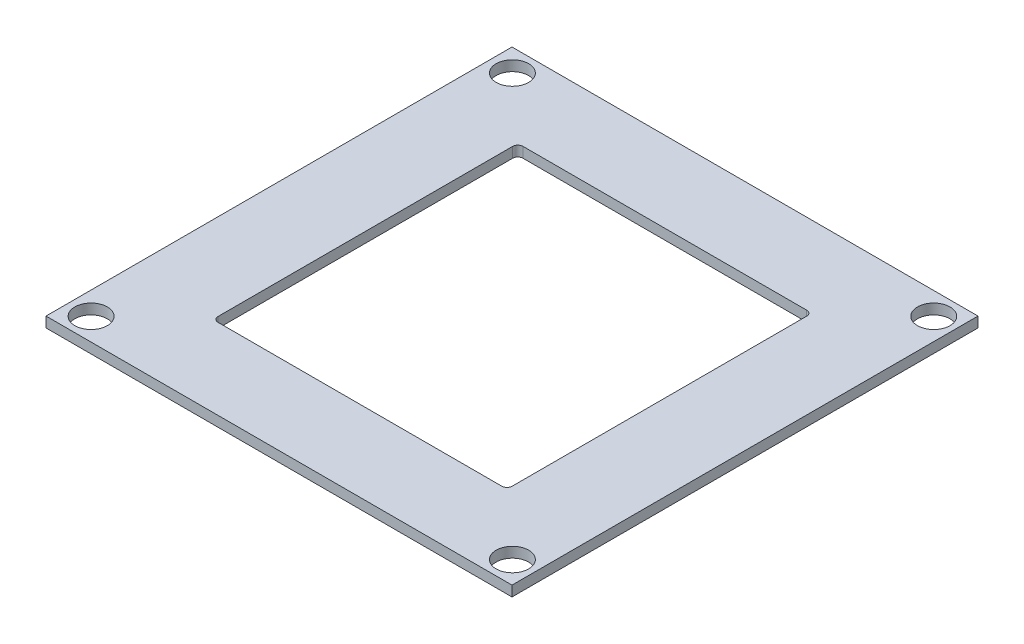
from build123d import *

# Parameters (mm, degrees)
SKETCH1_W           = 286.791999948
SKETCH1_H           = 286.791999948
BOSS_EXTRUDE1_DEPTH = 6.35
SKETCH2_R           = 10
SKETCH2_W           = 180.979932016
SKETCH2_H           = 187.647432016
CUT_EXTRUDE1_DEPTH  = 6.35
FILLET1_R           = 3.175


with BuildPart() as part:
    # Sketch1 → Boss-Extrude1 (new body)
    with BuildSketch(Plane(origin=(0, 0, 0), x_dir=(1, 0, 0), z_dir=(0, 1, 0))):
        with Locations((143.395999974, 0)):
            Rectangle(SKETCH1_W, SKETCH1_H)
    extrude(amount=BOSS_EXTRUDE1_DEPTH)

    # Sketch2 → Cut-Extrude1 (cut)
    with BuildSketch(Plane.XZ):
        with Locations((273.299999948, -129.649999974)):
            Circle(SKETCH2_R)
        with Locations((14, -129.649999974)):
            Circle(SKETCH2_R)
        with Locations((14, 129.649999974)):
            Circle(SKETCH2_R)
        with Locations((273.299999948, 129.649999974)):
            Circle(SKETCH2_R)
        with Locations((143.649999974, 0)):
            Rectangle(SKETCH2_W, SKETCH2_H)
    extrude(amount=-CUT_EXTRUDE1_DEPTH, mode=Mode.SUBTRACT)

    # Fillet1
    fillet1_edges = [part.edges().sort_by_distance(p)[0] for p in [
        (53.160033966, 3.175, -93.823716008),
        (234.139965982, 3.175, -93.823716008),
        (234.139965982, 3.175, 93.823716008),
        (53.160033966, 3.175, 93.823716008),
    ]]
    fillet(fillet1_edges, radius=FILLET1_R)


solid = part.part
